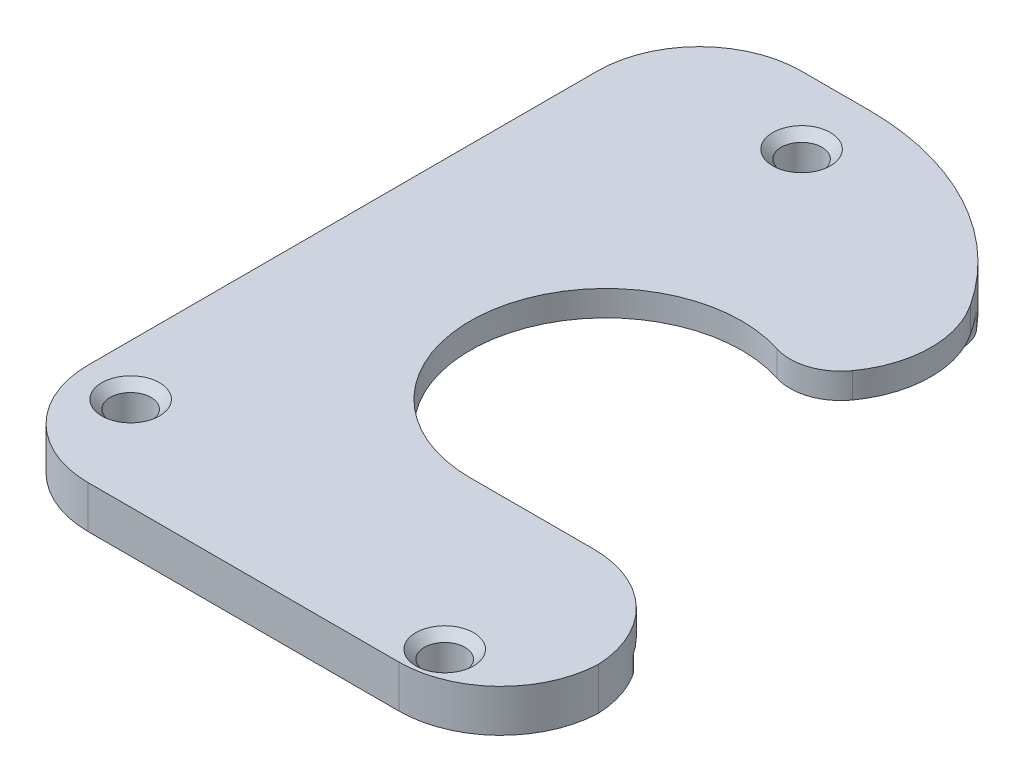
from build123d import *

# Parameters (mm, degrees)
BOSS_EXTRU_1_DEPTH      = 2.5
ESQUISSE2_R             = 1.2
ENL_V_MAT_EXTRU_1_DEPTH = 29.310775334
CONG_1_R                = 6
CONG_3_R                = 3
ESQUISSE4_R             = 14
ENL_V_MAT_EXTRU_2_DEPTH = 1
CONG_5_R                = 2
CHANFREIN1_SIZE         = 0.5


with BuildPart() as part:
    # Esquisse1 → Boss.-Extru.1 (new body)
    with BuildSketch(Plane(origin=(0, 0, 0), x_dir=(1, 0, 0), z_dir=(0, 1, 0))):
        with BuildLine():
            Line((-17, 22.5), (-17, -19.5))
            Line((-17, -19.5), (13.3, -19.5))
            Line((13.3, -19.5), (13.3, -8))
            Line((13.3, -8), (0, -8))
            ThreePointArc((0, -8), (-7.745966692, 2), (3.872983346, 7))
            Line((3.872983346, 7), (8.485281374, 7))
            ThreePointArc((8.485281374, 7), (3.954952524, 17.959261462), (-7, 22.5))
            Line((-7, 22.5), (-17, 22.5))
        make_face()
    extrude(amount=BOSS_EXTRU_1_DEPTH)

    # Esquisse2 → Enlèv. mat.-Extru.1 (cut, through all)
    with BuildSketch(Plane(origin=(0, 2.5, 0), x_dir=(1, 0, 0), z_dir=(0, 1, 0))):
        with Locations(Location((-14, -14, 0), (0, 0, 270))):
            Circle(ESQUISSE2_R)
        with Locations(Location((-7, 18.521339044, 0), (0, 0, 270))):
            Circle(ESQUISSE2_R)
        with Locations(Location((8, -17.5, 0), (0, 0, 270))):
            Circle(ESQUISSE2_R)
    extrude(amount=-ENL_V_MAT_EXTRU_1_DEPTH, mode=Mode.SUBTRACT)

    # Congé1
    # the kernel refuses this fillet: 6 mm, written as the material it takes off along each edge
    with BuildSketch(Plane(origin=(-17, -15, -22.5), x_dir=(0, 0, 1), z_dir=(0, 1, 0))) as cong_1_piece_1:
        with BuildLine():
            CenterArc((CONG_1_R, CONG_1_R), CONG_1_R, 180, 90)
            Line((0, CONG_1_R), (-CONG_1_R * 0.02, CONG_1_R))
            Line((-CONG_1_R * 0.02, CONG_1_R), (-CONG_1_R * 0.02, -CONG_1_R * 0.02))
            Line((-CONG_1_R * 0.02, -CONG_1_R * 0.02), (CONG_1_R, -CONG_1_R * 0.02))
            Line((CONG_1_R, -CONG_1_R * 0.02), (CONG_1_R, 0))
        make_face()
    extrude(amount=32.5, mode=Mode.SUBTRACT)
    with BuildSketch(Plane(origin=(-17, -15, 19.5), x_dir=(0, 0, -1), z_dir=(0, 1, 0)), Plane(origin=(13.3, -15, 8), x_dir=(0, 0, 1), z_dir=(0, 1, 0)), Plane(origin=(13.3, -15, 19.5), x_dir=(-1, 0, 0), z_dir=(0, 1, 0))) as cong_1_piece_2:
        with BuildLine():
            CenterArc((CONG_1_R, -CONG_1_R), CONG_1_R, 90, 90)
            Line((0, -CONG_1_R), (-CONG_1_R * 0.02, -CONG_1_R))
            Line((-CONG_1_R * 0.02, -CONG_1_R), (-CONG_1_R * 0.02, CONG_1_R * 0.02))
            Line((-CONG_1_R * 0.02, CONG_1_R * 0.02), (CONG_1_R, CONG_1_R * 0.02))
            Line((CONG_1_R, CONG_1_R * 0.02), (CONG_1_R, 0))
        make_face()
    extrude(amount=32.5, mode=Mode.SUBTRACT)
    with BuildSketch(Plane(origin=(8.485281374, -22.237247638, -7), x_dir=(-0.2862946812834453, 0, -0.9581416155604611), z_dir=(0, 1, 0))) as cong_1_piece_3:
        with BuildLine():
            CenterArc((7.171670108, 5.747215151), CONG_1_R, 192.787166877, 93.903519848)
            Line((1.320476394, 4.419234684), (1.20345252, 4.392675075))
            ThreePointArc((1.20345252, 4.392675075), (0.545261203, 2.243972704), (-0.114976994, 0.034355362))
            Line((-0.114976994, 0.034355362), (-0.034464579, -0.114944303))
            ThreePointArc((-0.034464579, -0.114944303), (4.447449528, -0.772407713), (8.929363634, -0.114944303))
            Line((8.929363634, -0.114944303), (8.894899055, 0))
        make_face()
    extrude(amount=46.974495277, mode=Mode.SUBTRACT)

    # Congé3
    cong_3_edges = [part.edges().sort_by_distance(p)[0] for p in [
        (3.872983346, 1.25, -7),
    ]]
    fillet(cong_3_edges, radius=CONG_3_R)

    # Esquisse4 → Enlèv. mat.-Extru.2 (cut)
    with BuildSketch(Plane.XZ):
        Circle(ESQUISSE4_R)
    extrude(amount=-ENL_V_MAT_EXTRU_2_DEPTH, mode=Mode.SUBTRACT)

    # Congé5
    # the kernel refuses this fillet: 2 mm, written as the material it takes off along each edge
    with BuildSketch(Plane(origin=(10.685001077, 1, 9.046035153), x_dir=(-0.696384745978129, 0, 0.7176686460818646), z_dir=(0, -1, 0))) as cong_5_piece_1:
        with BuildLine():
            CenterArc((2.033177058, -1.995401593), CONG_5_R, 93.886060886, 100.219627186)
            ThreePointArc((0.093481407, -2.482824183), (-0.083183309, -1.246303892), (0, 0))
            ThreePointArc((0, 0), (0.94881596, -0.032188852), (1.897631921, 0))
        make_face()
    extrude(amount=7.211458513, mode=Mode.SUBTRACT)
    with BuildSketch(Plane(origin=(6.925136159, 1, -12.16727123), x_dir=(-0.39164389481893525, 0, -0.9201168728216296), z_dir=(0, -1, 0))) as cong_5_piece_2:
        with BuildLine():
            CenterArc((4.592043661, -1.915459486), CONG_5_R, 73.281516472, 141.913205532)
            Line((2.957647671, -3.068173565), (2.794208072, -3.183444973))
            ThreePointArc((2.794208072, -3.183444973), (1.45226122, -1.559692524), (-0.121187489, -0.159102459))
            Line((-0.121187489, -0.159102459), (-0.080128667, 0.183246819))
            ThreePointArc((-0.080128667, 0.183246819), (3.50925175, 0.603260074), (5.224916554, 0.191545949))
            Line((5.224916554, 0.191545949), (5.167382655, 0))
        make_face()
    extrude(amount=13.918456637, mode=Mode.SUBTRACT)

    # Chanfrein1
    chanfrein1_edges = [part.edges().sort_by_distance(p)[0] for p in [
        (-14, 2.5, 12.8),
        (-7, 2.5, -19.721339044),
        (8, 2.5, 16.3),
    ]]
    chamfer(chanfrein1_edges, length=CHANFREIN1_SIZE)


solid = part.part
